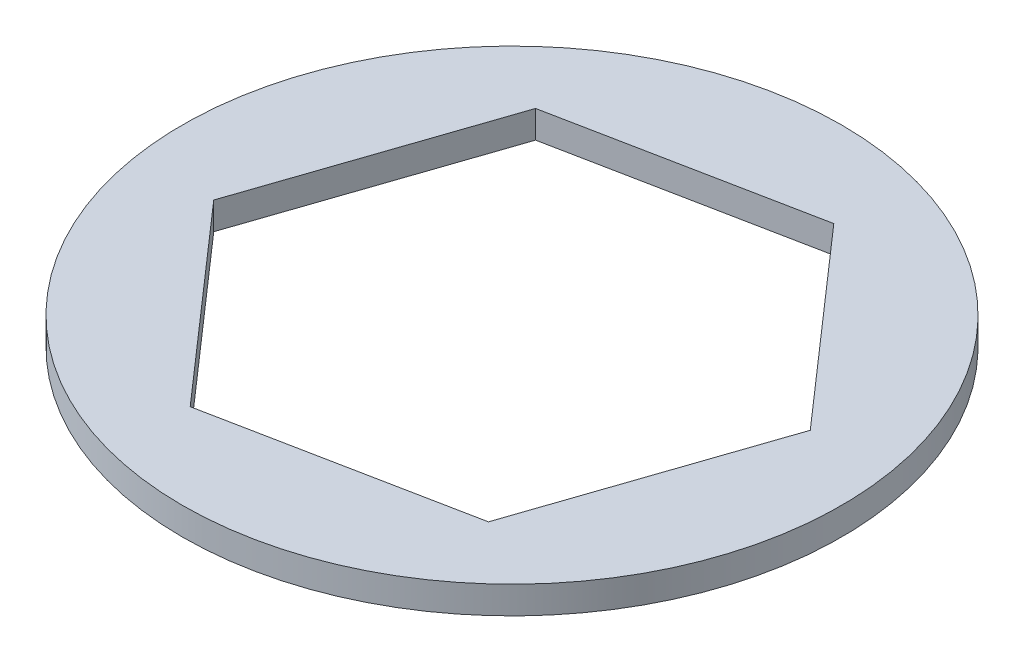
from build123d import *

# Parameters (mm, degrees)
SKETCH1_R           = 9.525
BOSS_EXTRUDE1_DEPTH = 0.79375


with BuildPart() as part:
    # Sketch1 → Boss-Extrude1 (new body)
    with BuildSketch(Plane(origin=(0, 0, 0), x_dir=(1, 0, 0), z_dir=(0, 1, 0))):
        Circle(SKETCH1_R)
        Polygon((2.358616898, 6.942640684), (-4.833194753, 5.513942493), (-7.19181165, -1.428698191), (-2.358616898, -6.942640684), (4.833194753, -5.513942493), (7.19181165, 1.428698191), align=None, mode=Mode.SUBTRACT)
    extrude(amount=BOSS_EXTRUDE1_DEPTH)


solid = part.part
